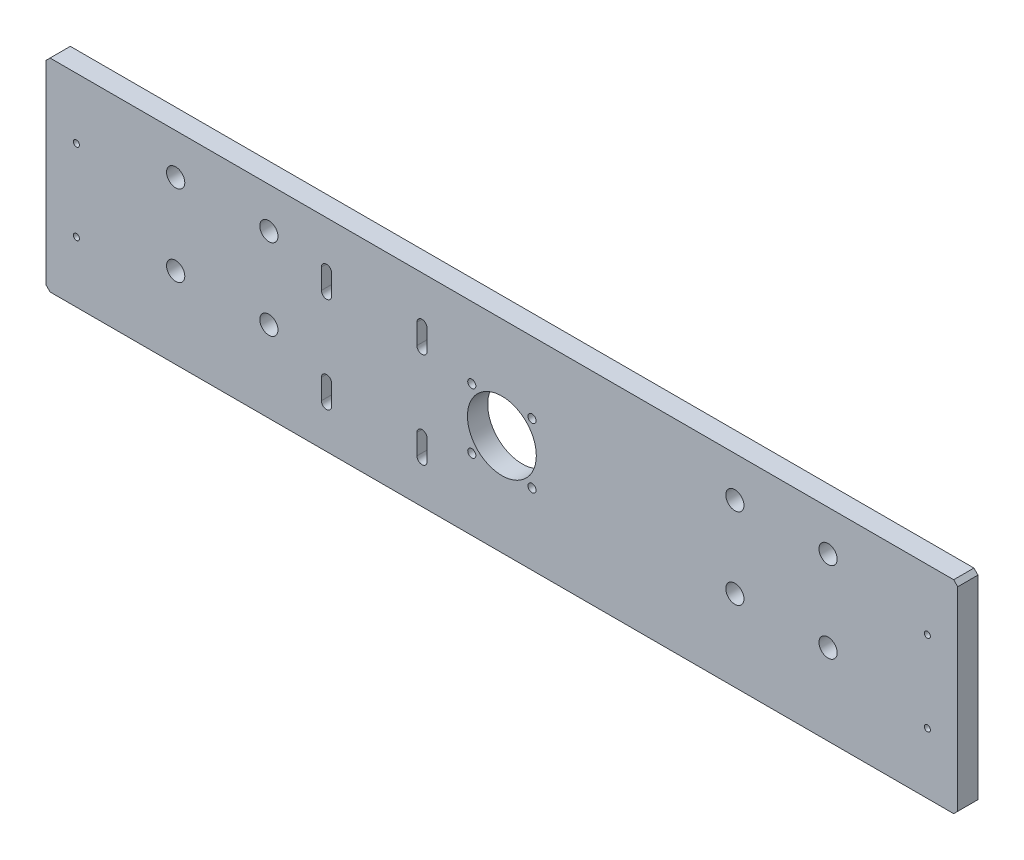
from build123d import *

# Parameters (mm, degrees)
SCHIZZO1_R          = 17
SCHIZZO1_R_2        = 2
SCHIZZO1_R_3        = 4.5
SCHIZZO1_R_4        = 1.5
BOSS_EXTRUDE1_DEPTH = 10
CUT_EXTRUDE1_DEPTH  = 462.085675336


with BuildPart() as part:
    # Schizzo1 → Boss-Extrude1 (new body)
    with BuildSketch(Plane.XY):
        Polygon((2, 0), (448, 0), (450, 2), (450, 98), (448, 100), (2, 100), (0, 98), (0, 2), align=None)
        with Locations((225, 50)):
            Circle(SCHIZZO1_R, mode=Mode.SUBTRACT)
        with Locations((239.849242405, 64.849242405)):
            Circle(SCHIZZO1_R_2, mode=Mode.SUBTRACT)
        with Locations((239.849242405, 35.150757595)):
            Circle(SCHIZZO1_R_2, mode=Mode.SUBTRACT)
        with Locations((210.150757595, 35.150757595)):
            Circle(SCHIZZO1_R_2, mode=Mode.SUBTRACT)
        with Locations((386, 40)):
            Circle(SCHIZZO1_R_3, mode=Mode.SUBTRACT)
        with Locations((386, 80)):
            Circle(SCHIZZO1_R_3, mode=Mode.SUBTRACT)
        with Locations((340, 40)):
            Circle(SCHIZZO1_R_3, mode=Mode.SUBTRACT)
        with Locations((340, 80)):
            Circle(SCHIZZO1_R_3, mode=Mode.SUBTRACT)
        with Locations((435, 70)):
            Circle(SCHIZZO1_R_4, mode=Mode.SUBTRACT)
        with Locations((435, 30)):
            Circle(SCHIZZO1_R_4, mode=Mode.SUBTRACT)
        with Locations((15, 30)):
            Circle(SCHIZZO1_R_4, mode=Mode.SUBTRACT)
        with Locations((210.150757595, 64.849242405)):
            Circle(SCHIZZO1_R_2, mode=Mode.SUBTRACT)
        with Locations((15, 70)):
            Circle(SCHIZZO1_R_4, mode=Mode.SUBTRACT)
        with Locations((110, 80)):
            Circle(SCHIZZO1_R_3, mode=Mode.SUBTRACT)
        with Locations((110, 40)):
            Circle(SCHIZZO1_R_3, mode=Mode.SUBTRACT)
        with Locations((64, 80)):
            Circle(SCHIZZO1_R_3, mode=Mode.SUBTRACT)
        with Locations((64, 40)):
            Circle(SCHIZZO1_R_3, mode=Mode.SUBTRACT)
    extrude(amount=-BOSS_EXTRUDE1_DEPTH)

    # Sketch1 → Cut-Extrude1 (cut, through all)
    with BuildSketch(Plane(origin=(0, 0, -10), x_dir=(-1, 0, 0), z_dir=(0, 0, -1))):
        with BuildLine():
            Line((-188.077099496, 67.62422726), (-188.077099496, 77.62422726))
            ThreePointArc((-188.077099496, 77.62422726), (-185.577099496, 80.12422726), (-183.077099496, 77.62422726))
            Line((-183.077099496, 77.62422726), (-183.077099496, 67.62422726))
            ThreePointArc((-183.077099496, 67.62422726), (-185.577099496, 65.12422726), (-188.077099496, 67.62422726))
        make_face()
        with BuildLine():
            Line((-140.937099496, 67.62422726), (-140.937099496, 77.62422726))
            ThreePointArc((-140.937099496, 77.62422726), (-138.437099496, 80.12422726), (-135.937099496, 77.62422726))
            Line((-135.937099496, 77.62422726), (-135.937099496, 67.62422726))
            ThreePointArc((-135.937099496, 67.62422726), (-138.437099496, 65.12422726), (-140.937099496, 67.62422726))
        make_face()
        with BuildLine():
            Line((-188.077099496, 20.48422726), (-188.077099496, 30.48422726))
            ThreePointArc((-188.077099496, 30.48422726), (-185.577099496, 32.98422726), (-183.077099496, 30.48422726))
            Line((-183.077099496, 30.48422726), (-183.077099496, 20.48422726))
            ThreePointArc((-183.077099496, 20.48422726), (-185.577099496, 17.98422726), (-188.077099496, 20.48422726))
        make_face()
        with BuildLine():
            Line((-140.937099496, 20.48422726), (-140.937099496, 30.48422726))
            ThreePointArc((-140.937099496, 30.48422726), (-138.437099496, 32.98422726), (-135.937099496, 30.48422726))
            Line((-135.937099496, 30.48422726), (-135.937099496, 20.48422726))
            ThreePointArc((-135.937099496, 20.48422726), (-138.437099496, 17.98422726), (-140.937099496, 20.48422726))
        make_face()
    extrude(amount=-CUT_EXTRUDE1_DEPTH, mode=Mode.SUBTRACT)


solid = part.part
